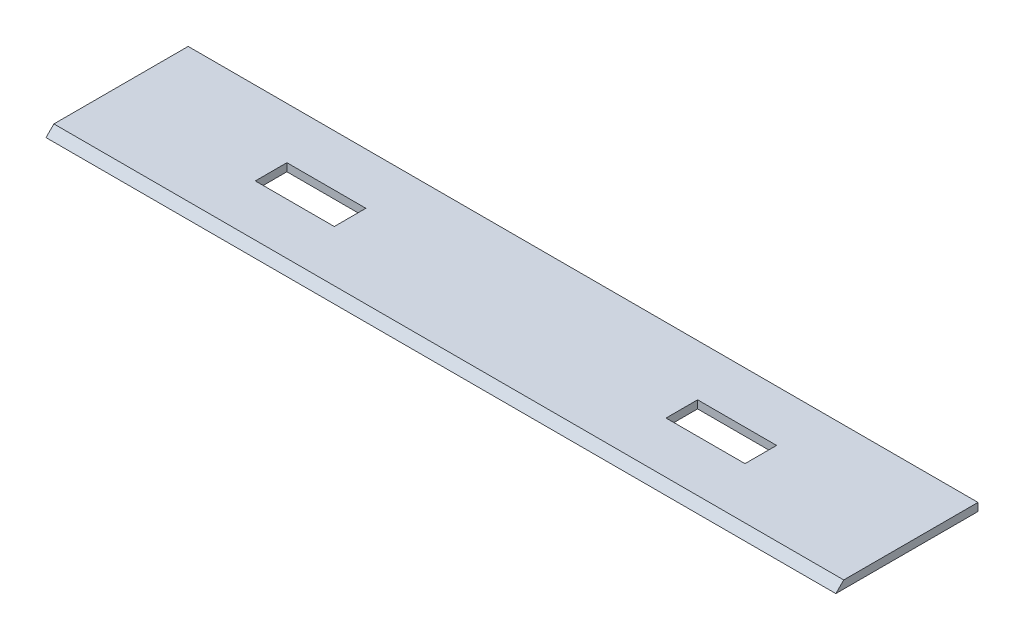
from build123d import *

# Parameters (mm, degrees)
SKETCH_1_W          = 100
SKETCH_1_H          = 18
EXTRUDE_1_DEPTH     = 1
CHAMFER_1_SIZE      = 1
SKETCH_2_W          = 10
SKETCH_2_H          = 4
CUT_EXTRUDE_1_DEPTH = 1


with BuildPart() as part:
    # Эскиз1 → Бобышка-Вытянуть1 (new body)
    with BuildSketch(Plane(origin=(0, 0, 0), x_dir=(1, 0, 0), z_dir=(0, 1, 0))):
        Rectangle(SKETCH_1_W, SKETCH_1_H)
    extrude(amount=EXTRUDE_1_DEPTH)

    # Фаска1
    chamfer_1_edges = [part.edges().sort_by_distance(p)[0] for p in [
        (0, 1, 9),
    ]]
    chamfer(chamfer_1_edges, length=CHAMFER_1_SIZE - 0.0001)  # a hair under: the kernel refuses the full size

    # Эскиз2 → Вырез-Вытянуть1 (cut)
    with BuildSketch(Plane(origin=(0, 1, 0), x_dir=(1, 0, 0), z_dir=(0, 1, 0))):
        with Locations((-26, 0.5)):
            Rectangle(SKETCH_2_W, SKETCH_2_H)
        with Locations((26, 0.5)):
            Rectangle(SKETCH_2_W, SKETCH_2_H)
    extrude(amount=-CUT_EXTRUDE_1_DEPTH, mode=Mode.SUBTRACT)


solid = part.part
